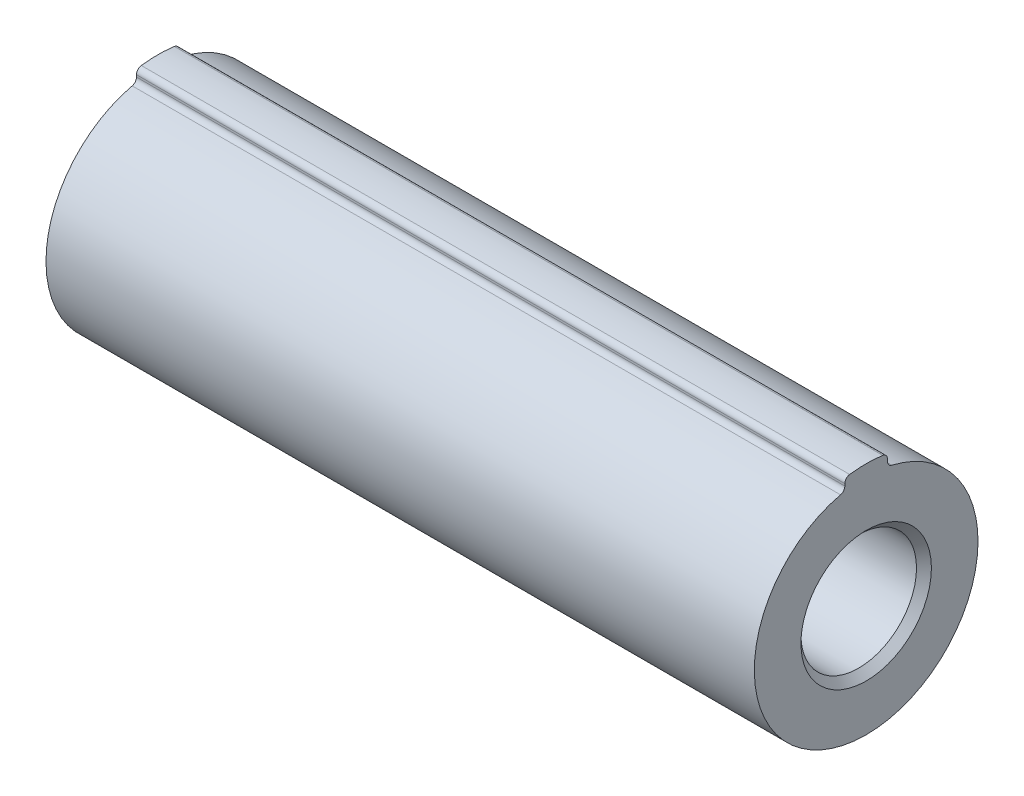
from build123d import *

# Parameters (mm, degrees)
EXTRUDE_1_DEPTH      = 18
EXTRUDE_1_DEPTH_BACK = 20
SKETCH_1_R           = 6
SKETCH_3_R           = 3.1
CUT_EXTRUDE_1_DEPTH  = 16
SKETCH_4_R           = 4.1
CUT_EXTRUDE_2_DEPTH  = 20
EXTRUDE_START        = 12
EXTRUDE_2_DEPTH      = 12
EXTRUDE_START_2      = 15
EXTRUDE_3_DEPTH      = 15
CHAMFER_1_SIZE       = 0.4
CHAMFER_2_SIZE       = 0.5
EXTRUDE_4_REACH      = 40.936
FILLET_1_R           = 0.3


with BuildPart() as part:
    # 草图1 → 凸台-拉伸1 (new, two sides: drawn at the far end of the back side and taken through both)
    with BuildSketch(Plane(origin=(0, 0, 0), x_dir=(0, 0, -1), z_dir=(1, 0, 0)).offset(-EXTRUDE_1_DEPTH_BACK)):
        Circle(SKETCH_1_R)
    extrude(amount=EXTRUDE_1_DEPTH + EXTRUDE_1_DEPTH_BACK)

    # 草图3 → 切除-拉伸1 (cut)
    with BuildSketch(Plane(origin=(18, 0, 0), x_dir=(0, 0, -1), z_dir=(1, 0, 0))):
        Circle(SKETCH_3_R)
    extrude(amount=-CUT_EXTRUDE_1_DEPTH, mode=Mode.SUBTRACT)

    # 草图4 → 切除-拉伸2 (cut)
    with BuildSketch(Plane.ZY.offset(20)):
        Circle(SKETCH_4_R)
    extrude(amount=-CUT_EXTRUDE_2_DEPTH, mode=Mode.SUBTRACT)

    # 草图5 → 凸台-拉伸2 (add)
    with BuildSketch(Plane(origin=(2, 0, 0), x_dir=(0, 0, -1), z_dir=(1, 0, 0)).offset(EXTRUDE_START)):
        with BuildLine():
            Line((-1.688194302, 2.6), (1.688194302, 2.6))
            ThreePointArc((1.688194302, 2.6), (0, 3.1), (-1.688194302, 2.6))
        make_face()
    extrude(amount=-EXTRUDE_2_DEPTH)

    # 草图6 → 凸台-拉伸3 (add)
    with BuildSketch(Plane.ZY.offset(EXTRUDE_START_2)):
        with BuildLine():
            Line((-1.748205844, 3.708608408), (2.169358352, 3.479063716))
            ThreePointArc((2.169358352, 3.479063716), (0.239822956, 4.09297996), (-1.748205844, 3.708608408))
        make_face()
    extrude(amount=-EXTRUDE_3_DEPTH)

    # 倒角1
    chamfer_1_edges = [part.edges().sort_by_distance(p)[0] for p in [
        (-20, 0, -4.1),
        (18, 0, 3.1),
    ]]
    chamfer(chamfer_1_edges, length=CHAMFER_1_SIZE)

    # 倒角2
    chamfer_2_edges = [part.edges().sort_by_distance(p)[0] for p in [
        (-15, 3.593836062, 0.210576254),
        (14, 2.6, 0),
    ]]
    chamfer(chamfer_2_edges, length=CHAMFER_2_SIZE - 0.0001)  # a hair under: the kernel refuses the full size

    # 凸台-拉伸4: up to this face of the body (flat: up to its plane)
    extrude_4_end = Plane(part.part.faces().sort_by_distance((-20, 0, -4.669705627))[0])
    # 草图7 → 凸台-拉伸4 (add, up to the picked face)
    with BuildSketch(Plane(origin=(18, 0, 0), x_dir=(0, 0, -1), z_dir=(1, 0, 0)), mode=Mode.PRIVATE) as extrude_4_sk1:
        with BuildLine():
            Line((-1.144552314, 6.5), (-1.144552314, 4))
            Line((-1.144552314, 4), (1.144552314, 4))
            Line((1.144552314, 4), (1.144552314, 6.5))
            ThreePointArc((1.144552314, 6.5), (0, 6.6), (-1.144552314, 6.5))
        make_face()
    extrude_4_tool1 = split(extrude(extrude_4_sk1.sketch, amount=-EXTRUDE_4_REACH, mode=Mode.PRIVATE), bisect_by=extrude_4_end, keep=Keep.BOTH, mode=Mode.PRIVATE)
    add(extrude_4_tool1.solids().sort_by(Axis((18, 5.283557, 0), (-1, 0, 0)))[0])

    # 圆角1
    fillet_1_edges = [part.edges().sort_by_distance(p)[0] for p in [
        (-1, 5.889821729, -1.144552314),
        (-1, 6.5, -1.144552314),
        (-1, 5.889821729, 1.144552314),
        (-1, 6.5, 1.144552314),
    ]]
    fillet(fillet_1_edges, radius=FILLET_1_R)


solid = part.part
